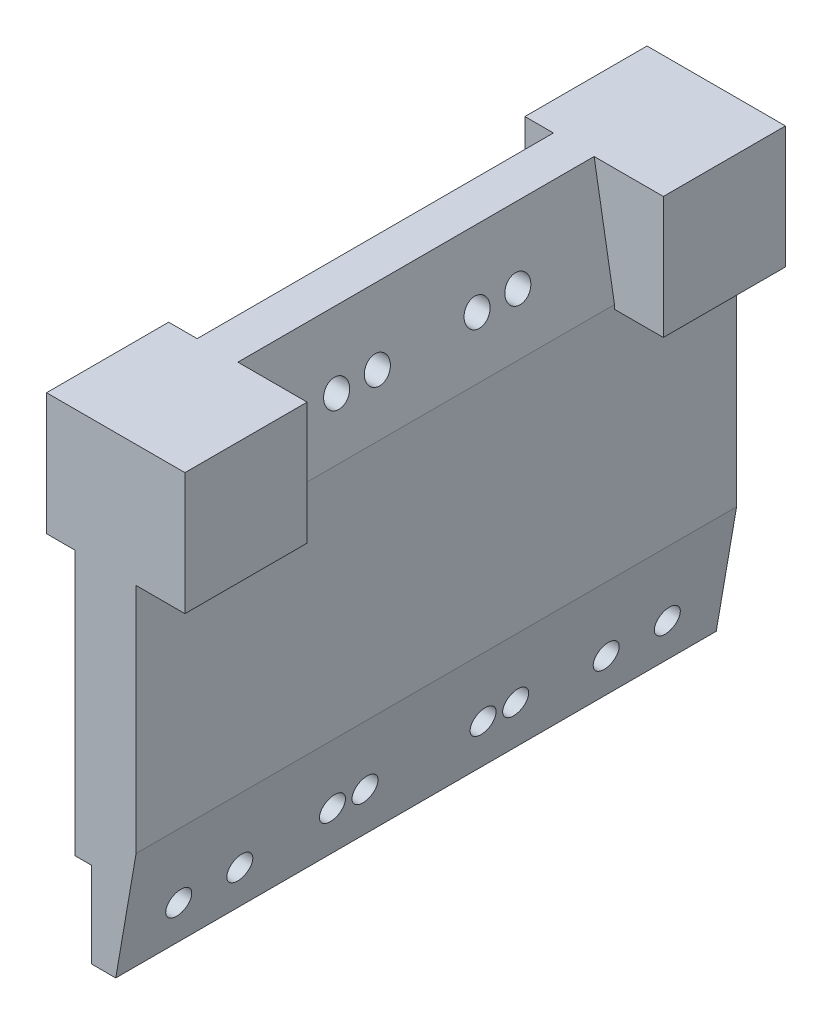
from build123d import *

# Parameters (mm, degrees)
BOSS_EXTRUDE1_DEPTH      = 73.75
BOSS_EXTRUDE1_DEPTH_BACK = 73.75
SKETCH2_R                = 1.5
CUT_EXTRUDE1_DEPTH       = 139.275314138
SKETCH3_R                = 3.15
CUT_EXTRUDE2_DEPTH       = 10
SKETCH4_W                = 147.5
SKETCH4_H                = 21
CUT_EXTRUDE3_DEPTH       = 4
SKETCH6_R                = 1.65
CUT_EXTRUDE4_DEPTH       = 139.275314138
SKETCH7_R                = 3.15
CUT_EXTRUDE6_DEPTH       = 10
SKETCH8_W                = 30
SKETCH8_H                = 30
BOSS_EXTRUDE2_DEPTH      = 7
SKETCH9_W                = 34
SKETCH9_H                = 30
BOSS_EXTRUDE3_DEPTH      = 30
SKETCH10_W               = 34
SKETCH10_H               = 30
BOSS_EXTRUDE4_DEPTH      = 30


with BuildPart() as part:
    # Sketch1 → Boss-Extrude1 (new, two sides: drawn at the far end of the back side and taken through both)
    with BuildSketch(Plane.XY.offset(-BOSS_EXTRUDE1_DEPTH_BACK)):
        Polygon((0, 0), (0, -116), (10, -116), (15, -87), (15, -29), (10, 0), align=None)
    extrude(amount=BOSS_EXTRUDE1_DEPTH + BOSS_EXTRUDE1_DEPTH_BACK)

    # Sketch2 → Cut-Extrude1 (cut, through all)
    with BuildSketch(Plane(origin=(15, 0, 0), x_dir=(0, 0, -1), z_dir=(1, 0, 0))):
        with Locations((60, -106)):
            Circle(SKETCH2_R)
        with Locations((45, -106)):
            Circle(SKETCH2_R)
        with Locations((22.5, -104.5)):
            Circle(SKETCH2_R)
        with Locations((14.5, -104.5)):
            Circle(SKETCH2_R)
        with Locations((-14.5, -104.5)):
            Circle(SKETCH2_R)
        with Locations((-22.5, -104.5)):
            Circle(SKETCH2_R)
        with Locations((-45, -106)):
            Circle(SKETCH2_R)
        with Locations((-60, -106)):
            Circle(SKETCH2_R)
    extrude(amount=-CUT_EXTRUDE1_DEPTH, mode=Mode.SUBTRACT)

    # Sketch3 → Cut-Extrude2 (cut)
    with BuildSketch(Plane(origin=(15, 0, 0), x_dir=(0, 0, -1), z_dir=(1, 0, 0))):
        with Locations((60, -106)):
            Circle(SKETCH3_R)
        with Locations((45, -106)):
            Circle(SKETCH3_R)
        with Locations((22.5, -104.5)):
            Circle(SKETCH3_R)
        with Locations((14.5, -104.5)):
            Circle(SKETCH3_R)
        with Locations((-14.5, -104.5)):
            Circle(SKETCH3_R)
        with Locations((-22.5, -104.5)):
            Circle(SKETCH3_R)
        with Locations((-45, -106)):
            Circle(SKETCH3_R)
        with Locations((-60, -106)):
            Circle(SKETCH3_R)
    extrude(amount=-CUT_EXTRUDE2_DEPTH, mode=Mode.SUBTRACT)

    # Sketch4 → Cut-Extrude3 (cut)
    with BuildSketch(Plane.ZY):
        with Locations((0, -105.5)):
            Rectangle(SKETCH4_W, SKETCH4_H)
    extrude(amount=-CUT_EXTRUDE3_DEPTH, mode=Mode.SUBTRACT)

    # Sketch6 → Cut-Extrude4 (cut, through all)
    with BuildSketch(Plane(origin=(15, 0, 0), x_dir=(0, 0, -1), z_dir=(1, 0, 0))):
        with Locations((12.25, -16)):
            Circle(SKETCH6_R)
        with Locations((22.25, -16)):
            Circle(SKETCH6_R)
        with Locations((-22.25, -16)):
            Circle(SKETCH6_R)
        with Locations((-12.25, -16)):
            Circle(SKETCH6_R)
    extrude(amount=-CUT_EXTRUDE4_DEPTH, mode=Mode.SUBTRACT)

    # Sketch7 → Cut-Extrude6 (cut)
    with BuildSketch(Plane(origin=(15, 0, 0), x_dir=(0, 0, -1), z_dir=(1, 0, 0))):
        with Locations((22.25, -16)):
            Circle(SKETCH7_R)
        with Locations((12.25, -16)):
            Circle(SKETCH7_R)
        with Locations((-12.25, -16)):
            Circle(SKETCH7_R)
        with Locations((-22.25, -16)):
            Circle(SKETCH7_R)
    extrude(amount=-CUT_EXTRUDE6_DEPTH, mode=Mode.SUBTRACT)

    # Sketch8 → Boss-Extrude2 (add)
    with BuildSketch(Plane.ZY):
        with Locations((58.75, -15)):
            Rectangle(SKETCH8_W, SKETCH8_H)
        with Locations((-58.75, -15)):
            Rectangle(SKETCH8_W, SKETCH8_H)
    extrude(amount=BOSS_EXTRUDE2_DEPTH)

    # Sketch9 → Boss-Extrude3 (add)
    with BuildSketch(Plane.XY.offset(73.75)):
        with Locations((10, -15)):
            Rectangle(SKETCH9_W, SKETCH9_H)
    extrude(amount=-BOSS_EXTRUDE3_DEPTH)

    # Sketch10 → Boss-Extrude4 (add)
    with BuildSketch(Plane(origin=(0, 0, -73.75), x_dir=(-1, 0, 0), z_dir=(0, 0, -1))):
        with Locations((-10, -15)):
            Rectangle(SKETCH10_W, SKETCH10_H)
    extrude(amount=-BOSS_EXTRUDE4_DEPTH)


solid = part.part
